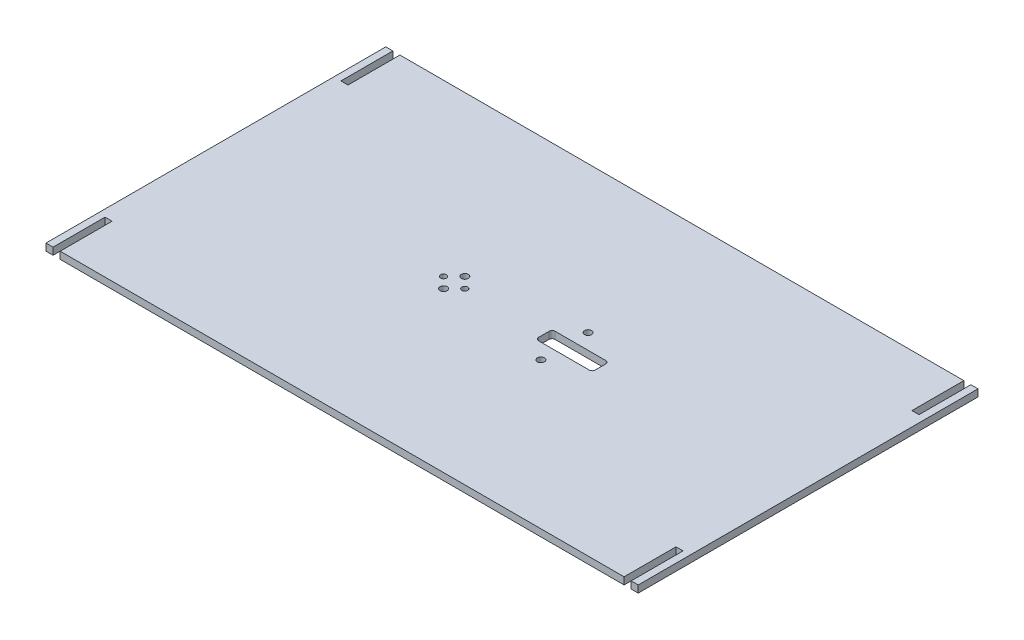
from build123d import *

# Parameters (mm, degrees)
BOSS_EXTRUDE1_DEPTH = 6
SKETCH2_R           = 3
SKETCH2_R_2         = 2.5
CUT_EXTRUDE1_DEPTH  = 6


with BuildPart() as part:
    # Sketch1 → Boss-Extrude1 (new body)
    with BuildSketch(Plane(origin=(0, 0, 0), x_dir=(1, 0, 0), z_dir=(0, 1, 0))):
        Polygon((478, 244), (484, 244), (484, 288), (490, 288), (490, 0), (484, 0), (484, 44), (478, 44), (478, 0), (0, 0), (0, 44), (-6, 44), (-6, 0), (-12, 0), (-12, 288), (-6, 288), (-6, 244), (0, 244), (0, 288), (478, 288), align=None)
    extrude(amount=BOSS_EXTRUDE1_DEPTH)

    # Sketch2 → Cut-Extrude1 (cut)
    with BuildSketch(Plane(origin=(0, 6, 0), x_dir=(1, 0, 0), z_dir=(0, 1, 0))):
        with Locations((190, 135)):
            Circle(SKETCH2_R)
        with Locations((190, 153)):
            Circle(SKETCH2_R)
        with Locations((181, 144)):
            Circle(SKETCH2_R_2)
        with Locations((199, 144)):
            Circle(SKETCH2_R_2)
        with Locations((283.5, 164)):
            Circle(SKETCH2_R)
        with Locations((283.5, 124)):
            Circle(SKETCH2_R)
        with BuildLine():
            Line((268.5, 137), (311.5, 137))
            ThreePointArc((311.5, 137), (313.267766953, 137.732233047), (314, 139.5))
            Line((314, 139.5), (314, 148.5))
            ThreePointArc((314, 148.5), (313.267766953, 150.267766953), (311.5, 151))
            Line((311.5, 151), (268.5, 151))
            ThreePointArc((268.5, 151), (266.732233047, 150.267766953), (266, 148.5))
            Line((266, 148.5), (266, 139.5))
            ThreePointArc((266, 139.5), (266.732233047, 137.732233047), (268.5, 137))
        make_face()
    extrude(amount=-CUT_EXTRUDE1_DEPTH, mode=Mode.SUBTRACT)


solid = part.part
